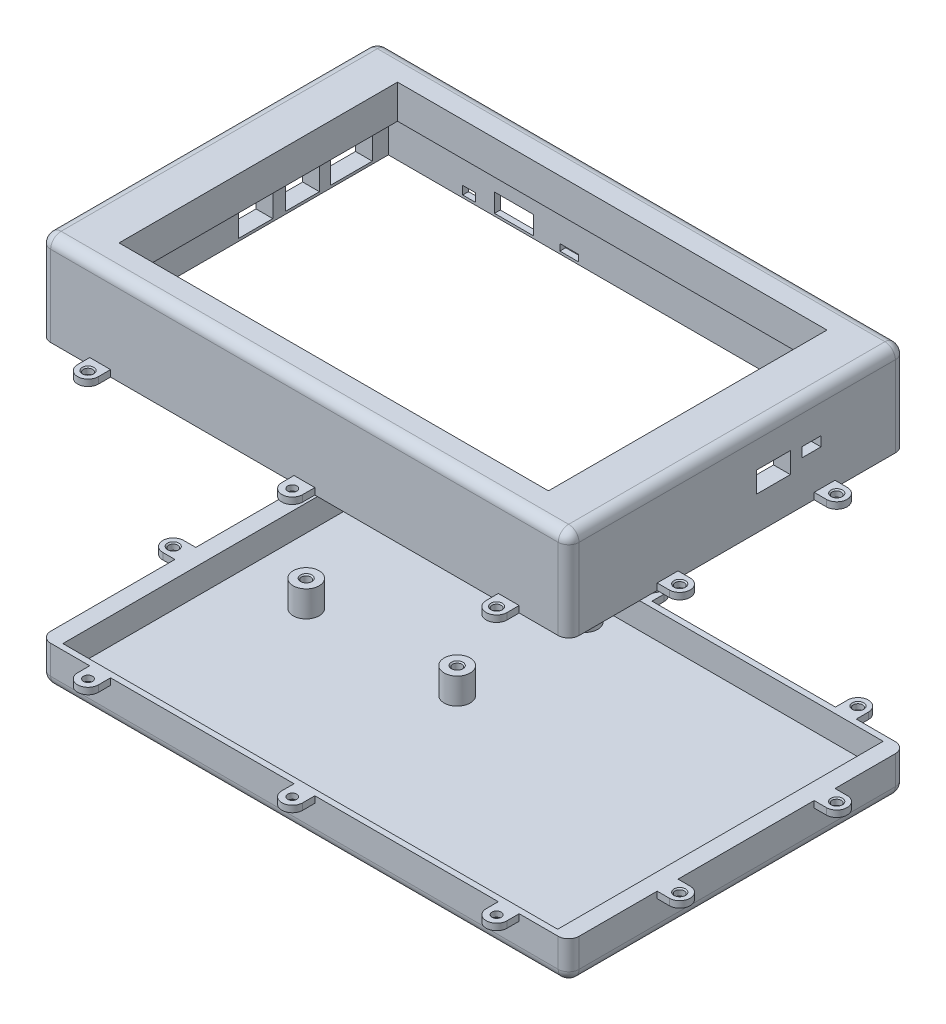
from build123d import *

# Parameters (mm, degrees)
SKETCH1_W                       = 202.9
SKETCH1_H                       = 129.45
BOSS_EXTRUDE1_DEPTH             = 25
FILLET3_R                       = 4
SKETCH2_W                       = 16
SKETCH2_H                       = 13.2
CUT_EXTRUDE1_DEPTH              = 21.6
SKETCH3_W                       = 13.1
SKETCH3_H                       = 16
CUT_EXTRUDE2_DEPTH              = 17.5
SKETCH4_W                       = 13.1
SKETCH4_H                       = 16
CUT_EXTRUDE3_DEPTH              = 17.5
SKETCH5_W                       = 4.9
SKETCH5_H                       = 3.2
CUT_EXTRUDE4_DEPTH              = 7.3
SKETCH7_W                       = 14.9
SKETCH7_H                       = 7.1
CUT_EXTRUDE5_DEPTH              = 11
SKETCH8_W                       = 7.2
SKETCH8_H                       = 2.5
CUT_EXTRUDE6_DEPTH              = 5
SKETCH17_W                      = 190
SKETCH17_H                      = 125
CUT_EXTRUDE9_DEPTH              = 10
SKETCH18_W                      = 164.9
SKETCH18_H                      = 106.95
CUT_EXTRUDE10_DEPTH             = 167.452480081
SKETCH19_W                      = 190
SKETCH19_H                      = 125
CUT_EXTRUDE11_DEPTH             = 22
SKETCH20_W                      = 8
SKETCH20_H                      = 2.5
BOSS_EXTRUDE2_DEPTH             = 8.66
FILLET4_RADIUS                  = 4
FILLET4_LENGTH                  = 2.5
SKETCH21_W                      = 8
SKETCH21_H                      = 2.5
BOSS_EXTRUDE3_DEPTH             = 8.66
FILLET5_RADIUS                  = 4
FILLET5_LENGTH                  = 2.5
SKETCH32_W                      = 8
SKETCH32_H                      = 2.5
BOSS_EXTRUDE6_DEPTH             = 8.66
BOSS_EXTRUDE6_2_DEPTH           = 8.66
BOSS_EXTRUDE6_3_DEPTH           = 8.66
FILLET8_RADIUS                  = 4
FILLET8_LENGTH                  = 2.5
FILLET9_RADIUS                  = 4
FILLET9_LENGTH                  = 2.5
FILLET10_RADIUS                 = 4
FILLET10_LENGTH                 = 2.5
SKETCH35_W                      = 8
SKETCH35_H                      = 2.5
BOSS_EXTRUDE7_DEPTH             = 8.66
FILLET11_RADIUS                 = 4
FILLET11_LENGTH                 = 2.5
FILLET12_RADIUS                 = 4
FILLET12_LENGTH                 = 2.5
FILLET13_RADIUS                 = 4
FILLET13_LENGTH                 = 2.5
F_1_0MM_DOWEL_HOLE6_AT_2_COUNT  = 2
F_1_0MM_DOWEL_HOLE6_AT_2_PITCH  = 78.45
F_1_0MM_DOWEL_HOLE6_AT_3_COUNT  = 2
F_1_0MM_DOWEL_HOLE6_AT_3_PITCH  = 156.9
SKETCH38_W                      = 8
SKETCH38_H                      = 2.5
BOSS_EXTRUDE8_DEPTH             = 8.66
BOSS_EXTRUDE8_2_DEPTH           = 8.66
SKETCH39_W                      = 8
SKETCH39_H                      = 2.5
BOSS_EXTRUDE9_DEPTH             = 8.66
FILLET14_RADIUS                 = 4
FILLET14_LENGTH                 = 2.5
FILLET15_RADIUS                 = 4
FILLET15_LENGTH                 = 2.5
FILLET16_RADIUS                 = 4
FILLET16_LENGTH                 = 2.5
FILLET17_RADIUS                 = 4
FILLET17_LENGTH                 = 2.5
F_1_0MM_DOWEL_HOLE8_AT_2_COUNT  = 2
F_1_0MM_DOWEL_HOLE8_AT_2_PITCH  = 60.28
SKETCH45_W                      = 8
SKETCH45_H                      = 2.5
BOSS_EXTRUDE10_DEPTH            = 8.66
BOSS_EXTRUDE10_2_DEPTH          = 8.66
BOSS_EXTRUDE10_3_DEPTH          = 8.66
FILLET18_RADIUS                 = 4
FILLET18_LENGTH                 = 2.5
FILLET19_RADIUS                 = 4
FILLET19_LENGTH                 = 2.5
FILLET20_RADIUS                 = 4
FILLET20_LENGTH                 = 2.5
SKETCH46_W                      = 8
SKETCH46_H                      = 2.5
BOSS_EXTRUDE11_DEPTH            = 8.66
FILLET21_RADIUS                 = 4
FILLET21_LENGTH                 = 2.5
FILLET22_RADIUS                 = 4
FILLET22_LENGTH                 = 2.5
FILLET23_RADIUS                 = 4
FILLET23_LENGTH                 = 2.5
F_1_0MM_DOWEL_HOLE9_AT_2_COUNT  = 2
F_1_0MM_DOWEL_HOLE9_AT_2_PITCH  = 78.45
F_1_0MM_DOWEL_HOLE9_AT_3_COUNT  = 2
F_1_0MM_DOWEL_HOLE9_AT_3_PITCH  = 156.9
SKETCH51_W                      = 7.2
SKETCH51_H                      = 3.7
SKETCH51_W_2                    = 13.1
SKETCH51_H_2                    = 8
CUT_EXTRUDE12_DEPTH             = 10
F_1_0MM_DOWEL_HOLE11_AT_2_COUNT = 2
F_1_0MM_DOWEL_HOLE11_AT_2_PITCH = 78.45
F_1_0MM_DOWEL_HOLE11_AT_3_COUNT = 2
F_1_0MM_DOWEL_HOLE11_AT_3_PITCH = 159.409897434
F_1_0MM_DOWEL_HOLE11_AT_4_COUNT = 2
F_1_0MM_DOWEL_HOLE11_AT_4_PITCH = 159.409897434
SKETCH58_R                      = 5
BOSS_EXTRUDE12_DEPTH            = 15
F_1_0MM_DOWEL_HOLE14_AT_2_COUNT = 2
F_1_0MM_DOWEL_HOLE14_AT_2_PITCH = 75.927597091
F_1_0MM_DOWEL_HOLE14_AT_3_COUNT = 2
F_1_0MM_DOWEL_HOLE14_AT_3_PITCH = 58
F_1_0MM_DOWEL_HOLE14_AT_4_COUNT = 2
F_1_0MM_DOWEL_HOLE14_AT_4_PITCH = 49


with BuildPart() as part:
    # Sketch1 → Boss-Extrude1 (new, symmetric)
    with BuildSketch(Plane(origin=(0, 0, 0), x_dir=(1, 0, 0), z_dir=(0, 1, 0))):
        Rectangle(SKETCH1_W, SKETCH1_H)
    extrude(amount=BOSS_EXTRUDE1_DEPTH, both=True)

    # Fillet3
    fillet3_edges = [part.edges().sort_by_distance(p)[0] for p in [
        (0, 25, -64.725),
        (101.45, 25, 0),
        (0, 25, 64.725),
        (101.45, -25, 0),
        (0, -25, -64.725),
        (-101.45, -25, 0),
        (0, -25, 64.725),
        (101.45, 0, 64.725),
        (101.45, 0, -64.725),
        (-101.45, 0, -64.725),
        (-101.45, 0, 64.725),
        (-101.45, 25, 0),
    ]]
    fillet(fillet3_edges, radius=FILLET3_R)

    # Sketch2 → Cut-Extrude1 (cut)
    with BuildSketch(Plane.ZY.offset(101.45)):
        with Locations((-48.33865756, -2.4)):
            Rectangle(SKETCH2_W, SKETCH2_H)
    extrude(amount=-CUT_EXTRUDE1_DEPTH, mode=Mode.SUBTRACT)

    # Sketch3 → Cut-Extrude2 (cut)
    with BuildSketch(Plane.ZY.offset(101.45)):
        with Locations((-29.48865756, -1)):
            Rectangle(SKETCH3_W, SKETCH3_H)
    extrude(amount=-CUT_EXTRUDE2_DEPTH, mode=Mode.SUBTRACT)

    # Sketch4 → Cut-Extrude3 (cut)
    with BuildSketch(Plane.ZY.offset(101.45)):
        with Locations((-11.58865756, -1)):
            Rectangle(SKETCH4_W, SKETCH4_H)
    extrude(amount=-CUT_EXTRUDE3_DEPTH, mode=Mode.SUBTRACT)

    # Sketch5 → Cut-Extrude4 (cut)
    with BuildSketch(Plane(origin=(0, 0, -64.725), x_dir=(-1, 0, 0), z_dir=(0, 0, -1))):
        with Locations((64, -7.45)):
            Rectangle(SKETCH5_W, SKETCH5_H)
    extrude(amount=-CUT_EXTRUDE4_DEPTH, mode=Mode.SUBTRACT)

    # Sketch7 → Cut-Extrude5 (cut)
    with BuildSketch(Plane(origin=(0, 0, -64.725), x_dir=(-1, 0, 0), z_dir=(0, 0, -1))):
        with Locations((46.8, -5.5)):
            Rectangle(SKETCH7_W, SKETCH7_H)
    extrude(amount=-CUT_EXTRUDE5_DEPTH, mode=Mode.SUBTRACT)

    # Sketch8 → Cut-Extrude6 (cut)
    with BuildSketch(Plane(origin=(0, 0, -64.725), x_dir=(-1, 0, 0), z_dir=(0, 0, -1))):
        with Locations((25.55, -7.8)):
            Rectangle(SKETCH8_W, SKETCH8_H)
    extrude(amount=-CUT_EXTRUDE6_DEPTH, mode=Mode.SUBTRACT)


with BuildPart() as body_2:
    # Split1: read off the stored shape, not the designer's step
    # Split1: the piece on the far side of the plane
    add(part.part)
    split(bisect_by=Plane(origin=(0, -10, 0), x_dir=(1, 0, 0), z_dir=(0, 1, 0)), keep=Keep.BOTTOM)

    # Sketch17 → Cut-Extrude9 (cut)
    with BuildSketch(Plane(origin=(0, -10, 0), x_dir=(1, 0, 0), z_dir=(0, 1, 0))):
        Rectangle(SKETCH17_W, SKETCH17_H)
    extrude(amount=-CUT_EXTRUDE9_DEPTH, mode=Mode.SUBTRACT)

    # Sketch21 → Boss-Extrude3 (add)
    with BuildSketch(Plane.ZY.offset(101.45)):
        with Locations((9, -11.25)):
            Rectangle(SKETCH21_W, SKETCH21_H)
    extrude(amount=BOSS_EXTRUDE3_DEPTH)

    # Fillet5: full round fillet: the end face becomes a half cylinder, R = half its width
    fillet5_face = Plane((-110.11, -11.25, 9), x_dir=(0, -1, 0), z_dir=(-1, 0, 0))  # on the end face: x along it, z out of the body
    fillet5_slab = fillet5_face.offset(-FILLET5_RADIUS / 2) * Box(FILLET5_LENGTH, 2 * FILLET5_RADIUS, FILLET5_RADIUS, mode=Mode.PRIVATE)  # the body's end, R deep
    fillet5_round = Plane((-106.11, -11.25, 9), x_dir=(-1, 0, 0), z_dir=(0, -1, 0)) * Cylinder(FILLET5_RADIUS, FILLET5_LENGTH, mode=Mode.PRIVATE)  # its axis R under the face
    add(fillet5_slab - fillet5_round, mode=Mode.SUBTRACT)

    # Sketch25 → Ø1.0mm Dowel Hole2 (revolve, cut)
    with BuildSketch(Plane(origin=(-106.11, -10, 9), x_dir=(0, 0, 1), z_dir=(1, 0, 0))):
        Polygon((0, 0), (0, 2.5), (1.75, 2.5), (1.75, 0.45), (2.2, 0), align=None)
    revolve(axis=Axis((-106.11, -3.65, 9), (0, -1, 0)), mode=Mode.SUBTRACT)

    # Sketch35 → Boss-Extrude7 (add)
    with BuildSketch(Plane(origin=(0, 0, -64.725), x_dir=(-1, 0, 0), z_dir=(0, 0, -1))):
        with Locations((78.45, -11.25)):
            Rectangle(SKETCH35_W, SKETCH35_H)
        with Locations((-78.45, -11.25)):
            Rectangle(SKETCH35_W, SKETCH35_H)
        with Locations((0, -11.25)):
            Rectangle(SKETCH35_W, SKETCH35_H)
    extrude(amount=BOSS_EXTRUDE7_DEPTH)

    # Fillet11: full round fillet: the end face becomes a half cylinder, R = half its width
    fillet11_face = Plane((78.45, -11.25, -73.385), x_dir=(0, 1, 0), z_dir=(0, 0, -1))  # on the end face: x along it, z out of the body
    fillet11_slab = fillet11_face.offset(-FILLET11_RADIUS / 2) * Box(FILLET11_LENGTH, 2 * FILLET11_RADIUS, FILLET11_RADIUS, mode=Mode.PRIVATE)  # the body's end, R deep
    fillet11_round = Plane((78.45, -11.25, -69.385), x_dir=(0, 0, -1), z_dir=(0, 1, 0)) * Cylinder(FILLET11_RADIUS, FILLET11_LENGTH, mode=Mode.PRIVATE)  # its axis R under the face
    add(fillet11_slab - fillet11_round, mode=Mode.SUBTRACT)

    # Fillet12: full round fillet: the end face becomes a half cylinder, R = half its width
    fillet12_face = Plane((0, -11.25, -73.385), x_dir=(0, -1, 0), z_dir=(0, 0, -1))  # on the end face: x along it, z out of the body
    fillet12_slab = fillet12_face.offset(-FILLET12_RADIUS / 2) * Box(FILLET12_LENGTH, 2 * FILLET12_RADIUS, FILLET12_RADIUS, mode=Mode.PRIVATE)  # the body's end, R deep
    fillet12_round = Plane((0, -11.25, -69.385), x_dir=(0, 0, -1), z_dir=(0, -1, 0)) * Cylinder(FILLET12_RADIUS, FILLET12_LENGTH, mode=Mode.PRIVATE)  # its axis R under the face
    add(fillet12_slab - fillet12_round, mode=Mode.SUBTRACT)

    # Fillet13: full round fillet: the end face becomes a half cylinder, R = half its width
    fillet13_face = Plane((-78.45, -11.25, -73.385), x_dir=(0, -1, 0), z_dir=(0, 0, -1))  # on the end face: x along it, z out of the body
    fillet13_slab = fillet13_face.offset(-FILLET13_RADIUS / 2) * Box(FILLET13_LENGTH, 2 * FILLET13_RADIUS, FILLET13_RADIUS, mode=Mode.PRIVATE)  # the body's end, R deep
    fillet13_round = Plane((-78.45, -11.25, -69.385), x_dir=(0, 0, -1), z_dir=(0, -1, 0)) * Cylinder(FILLET13_RADIUS, FILLET13_LENGTH, mode=Mode.PRIVATE)  # its axis R under the face
    add(fillet13_slab - fillet13_round, mode=Mode.SUBTRACT)

    # Sketch37 → Ø1.0mm Dowel Hole6 (revolve, cut)
    with BuildSketch(Plane(origin=(-78.45, -10, -69.385), x_dir=(0, 0, 1), z_dir=(1, 0, 0))):
        Polygon((0, 0), (0, 2.501), (1.75, 2.501), (1.75, 0.45), (2.2, 0), align=None)
    f_1_0mm_dowel_hole6 = revolve(axis=Axis((-78.45, -3.65, -69.385), (0, -1, 0)), mode=Mode.SUBTRACT)

    # Ø1.0mm Dowel Hole6 at 2: Ø1.0mm Dowel Hole6 ×2
    with Locations(*[(i * F_1_0MM_DOWEL_HOLE6_AT_2_PITCH, 0, 0) for i in range(1, F_1_0MM_DOWEL_HOLE6_AT_2_COUNT)]):
        add(f_1_0mm_dowel_hole6, mode=Mode.SUBTRACT)

    # Ø1.0mm Dowel Hole6 at 3: Ø1.0mm Dowel Hole6 ×2
    with Locations(*[(i * F_1_0MM_DOWEL_HOLE6_AT_3_PITCH, 0, 0) for i in range(1, F_1_0MM_DOWEL_HOLE6_AT_3_COUNT)]):
        add(f_1_0mm_dowel_hole6, mode=Mode.SUBTRACT)

    # Sketch39 → Boss-Extrude9 (add)
    with BuildSketch(Plane(origin=(101.45, 0, 0), x_dir=(0, 0, -1), z_dir=(1, 0, 0))):
        with Locations((-26.725, -11.25)):
            Rectangle(SKETCH39_W, SKETCH39_H)
        with Locations((33.555, -11.25)):
            Rectangle(SKETCH39_W, SKETCH39_H)
    extrude(amount=BOSS_EXTRUDE9_DEPTH)

    # Fillet16: full round fillet: the end face becomes a half cylinder, R = half its width
    fillet16_face = Plane((110.11, -11.25, -33.555), x_dir=(0, -1, 0), z_dir=(1, 0, 0))  # on the end face: x along it, z out of the body
    fillet16_slab = fillet16_face.offset(-FILLET16_RADIUS / 2) * Box(FILLET16_LENGTH, 2 * FILLET16_RADIUS, FILLET16_RADIUS, mode=Mode.PRIVATE)  # the body's end, R deep
    fillet16_round = Plane((106.11, -11.25, -33.555), x_dir=(1, 0, 0), z_dir=(0, -1, 0)) * Cylinder(FILLET16_RADIUS, FILLET16_LENGTH, mode=Mode.PRIVATE)  # its axis R under the face
    add(fillet16_slab - fillet16_round, mode=Mode.SUBTRACT)

    # Fillet17: full round fillet: the end face becomes a half cylinder, R = half its width
    fillet17_face = Plane((110.11, -11.25, 26.725), x_dir=(0, 1, 0), z_dir=(1, 0, 0))  # on the end face: x along it, z out of the body
    fillet17_slab = fillet17_face.offset(-FILLET17_RADIUS / 2) * Box(FILLET17_LENGTH, 2 * FILLET17_RADIUS, FILLET17_RADIUS, mode=Mode.PRIVATE)  # the body's end, R deep
    fillet17_round = Plane((106.11, -11.25, 26.725), x_dir=(1, 0, 0), z_dir=(0, 1, 0)) * Cylinder(FILLET17_RADIUS, FILLET17_LENGTH, mode=Mode.PRIVATE)  # its axis R under the face
    add(fillet17_slab - fillet17_round, mode=Mode.SUBTRACT)

    # Sketch44 → Ø1.0mm Dowel Hole8 (revolve, cut)
    with BuildSketch(Plane(origin=(106.11, -10, 26.725), x_dir=(0, 0, 1), z_dir=(1, 0, 0))):
        Polygon((0, 0), (0, 2.501), (1.75, 2.501), (1.75, 0.45), (2.2, 0), align=None)
    f_1_0mm_dowel_hole8 = revolve(axis=Axis((106.11, -3.65, 26.725), (0, -1, 0)), mode=Mode.SUBTRACT)

    # Ø1.0mm Dowel Hole8 at 2: Ø1.0mm Dowel Hole8 ×2
    with Locations(*[(0, 0, -i * F_1_0MM_DOWEL_HOLE8_AT_2_PITCH) for i in range(1, F_1_0MM_DOWEL_HOLE8_AT_2_COUNT)]):
        add(f_1_0mm_dowel_hole8, mode=Mode.SUBTRACT)

    # Sketch46 → Boss-Extrude11 (add)
    with BuildSketch(Plane.XY.offset(64.725)):
        with Locations((78.45, -11.25)):
            Rectangle(SKETCH46_W, SKETCH46_H)
        with Locations((-78.45, -11.25)):
            Rectangle(SKETCH46_W, SKETCH46_H)
        with Locations((0, -11.25)):
            Rectangle(SKETCH46_W, SKETCH46_H)
    extrude(amount=BOSS_EXTRUDE11_DEPTH)

    # Fillet21: full round fillet: the end face becomes a half cylinder, R = half its width
    fillet21_face = Plane((78.45, -11.25, 73.385), x_dir=(0, 1, 0), z_dir=(0, 0, 1))  # on the end face: x along it, z out of the body
    fillet21_slab = fillet21_face.offset(-FILLET21_RADIUS / 2) * Box(FILLET21_LENGTH, 2 * FILLET21_RADIUS, FILLET21_RADIUS, mode=Mode.PRIVATE)  # the body's end, R deep
    fillet21_round = Plane((78.45, -11.25, 69.385), x_dir=(0, 0, 1), z_dir=(0, 1, 0)) * Cylinder(FILLET21_RADIUS, FILLET21_LENGTH, mode=Mode.PRIVATE)  # its axis R under the face
    add(fillet21_slab - fillet21_round, mode=Mode.SUBTRACT)

    # Fillet22: full round fillet: the end face becomes a half cylinder, R = half its width
    fillet22_face = Plane((0, -11.25, 73.385), x_dir=(0, 1, 0), z_dir=(0, 0, 1))  # on the end face: x along it, z out of the body
    fillet22_slab = fillet22_face.offset(-FILLET22_RADIUS / 2) * Box(FILLET22_LENGTH, 2 * FILLET22_RADIUS, FILLET22_RADIUS, mode=Mode.PRIVATE)  # the body's end, R deep
    fillet22_round = Plane((0, -11.25, 69.385), x_dir=(0, 0, 1), z_dir=(0, 1, 0)) * Cylinder(FILLET22_RADIUS, FILLET22_LENGTH, mode=Mode.PRIVATE)  # its axis R under the face
    add(fillet22_slab - fillet22_round, mode=Mode.SUBTRACT)

    # Fillet23: full round fillet: the end face becomes a half cylinder, R = half its width
    fillet23_face = Plane((-78.45, -11.25, 73.385), x_dir=(0, 1, 0), z_dir=(0, 0, 1))  # on the end face: x along it, z out of the body
    fillet23_slab = fillet23_face.offset(-FILLET23_RADIUS / 2) * Box(FILLET23_LENGTH, 2 * FILLET23_RADIUS, FILLET23_RADIUS, mode=Mode.PRIVATE)  # the body's end, R deep
    fillet23_round = Plane((-78.45, -11.25, 69.385), x_dir=(0, 0, 1), z_dir=(0, 1, 0)) * Cylinder(FILLET23_RADIUS, FILLET23_LENGTH, mode=Mode.PRIVATE)  # its axis R under the face
    add(fillet23_slab - fillet23_round, mode=Mode.SUBTRACT)

    # Sketch48 → Ø1.0mm Dowel Hole9 (revolve, cut)
    with BuildSketch(Plane(origin=(78.45, -12.5, 69.385), x_dir=(0, 0, -1), z_dir=(1, 0, 0))):
        Polygon((0, 0), (0, 2.501), (1.75, 2.501), (1.75, 0.45), (2.2, 0), align=None)
    f_1_0mm_dowel_hole9 = revolve(axis=Axis((78.45, -18.85, 69.385), (0, 1, 0)), mode=Mode.SUBTRACT)

    # Ø1.0mm Dowel Hole9 at 2: Ø1.0mm Dowel Hole9 ×2
    with Locations(*[(-i * F_1_0MM_DOWEL_HOLE9_AT_2_PITCH, 0, 0) for i in range(1, F_1_0MM_DOWEL_HOLE9_AT_2_COUNT)]):
        add(f_1_0mm_dowel_hole9, mode=Mode.SUBTRACT)

    # Ø1.0mm Dowel Hole9 at 3: Ø1.0mm Dowel Hole9 ×2
    with Locations(*[(-i * F_1_0MM_DOWEL_HOLE9_AT_3_PITCH, 0, 0) for i in range(1, F_1_0MM_DOWEL_HOLE9_AT_3_COUNT)]):
        add(f_1_0mm_dowel_hole9, mode=Mode.SUBTRACT)

    # Sketch58 → Boss-Extrude12 (add)
    with BuildSketch(Plane(origin=(0, -25, 0), x_dir=(-1, 0, 0), z_dir=(0, -1, 0))):
        with Locations(Location((12, 5.935, 0), (0, 0, 90))):
            Circle(SKETCH58_R)
        with Locations(Location((70, 54.935, 0), (0, 0, 90))):
            Circle(SKETCH58_R)
        with Locations(Location((70, 5.935, 0), (0, 0, 90))):
            Circle(SKETCH58_R)
        with Locations(Location((12, 54.935, 0), (0, 0, 90))):
            Circle(SKETCH58_R)
    extrude(amount=-BOSS_EXTRUDE12_DEPTH)

    # Sketch62 → Ø1.0mm Dowel Hole14 (revolve, cut)
    with BuildSketch(Plane(origin=(-12, -10, -54.935), x_dir=(0, 0, 1), z_dir=(1, 0, 0))):
        Polygon((0, 0), (0, 8.051506083), (1.75, 7), (1.75, 0.45), (2.2, 0), align=None)
    f_1_0mm_dowel_hole14 = revolve(axis=Axis((-12, -3.65, -54.935), (0, -1, 0)), mode=Mode.SUBTRACT)

    # Ø1.0mm Dowel Hole14 at 2: Ø1.0mm Dowel Hole14 ×2
    with Locations(*[Vector(-0.7638856255460448, 0, 0.6453516491682096) * (i * F_1_0MM_DOWEL_HOLE14_AT_2_PITCH) for i in range(1, F_1_0MM_DOWEL_HOLE14_AT_2_COUNT)]):
        add(f_1_0mm_dowel_hole14, mode=Mode.SUBTRACT)

    # Ø1.0mm Dowel Hole14 at 3: Ø1.0mm Dowel Hole14 ×2
    with Locations(*[(-i * F_1_0MM_DOWEL_HOLE14_AT_3_PITCH, 0, 0) for i in range(1, F_1_0MM_DOWEL_HOLE14_AT_3_COUNT)]):
        add(f_1_0mm_dowel_hole14, mode=Mode.SUBTRACT)

    # Ø1.0mm Dowel Hole14 at 4: Ø1.0mm Dowel Hole14 ×2
    with Locations(*[(0, 0, i * F_1_0MM_DOWEL_HOLE14_AT_4_PITCH) for i in range(1, F_1_0MM_DOWEL_HOLE14_AT_4_COUNT)]):
        add(f_1_0mm_dowel_hole14, mode=Mode.SUBTRACT)


with BuildPart() as part_1:
    add(part.part)

    # Split1
    split(bisect_by=Plane(origin=(0, -10, 0), x_dir=(1, 0, 0), z_dir=(0, 1, 0)), keep=Keep.TOP)


with BuildPart() as part_2:
    # Body-Move/Copy2: read off the stored shape, not the designer's step
    # Body-Move/Copy2: moved
    add(part_1.part.moved(Location((0, 100, 0))))

    # Sketch18 → Cut-Extrude10 (cut, through all)
    with BuildSketch(Plane.XZ.offset(-90)):
        Rectangle(SKETCH18_W, SKETCH18_H)
    extrude(amount=-CUT_EXTRUDE10_DEPTH, mode=Mode.SUBTRACT)

    # Sketch19 → Cut-Extrude11 (cut)
    with BuildSketch(Plane.XZ.offset(-90)):
        Rectangle(SKETCH19_W, SKETCH19_H)
    extrude(amount=-CUT_EXTRUDE11_DEPTH, mode=Mode.SUBTRACT)

    # Sketch20 → Boss-Extrude2 (add)
    with BuildSketch(Plane.ZY.offset(101.45)):
        with Locations((9, 91.25)):
            Rectangle(SKETCH20_W, SKETCH20_H)
    extrude(amount=BOSS_EXTRUDE2_DEPTH)

    # Fillet4: full round fillet: the end face becomes a half cylinder, R = half its width
    fillet4_face = Plane((-110.11, 91.25, 9), x_dir=(0, -1, 0), z_dir=(-1, 0, 0))  # on the end face: x along it, z out of the body
    fillet4_slab = fillet4_face.offset(-FILLET4_RADIUS / 2) * Box(FILLET4_LENGTH, 2 * FILLET4_RADIUS, FILLET4_RADIUS, mode=Mode.PRIVATE)  # the body's end, R deep
    fillet4_round = Plane((-106.11, 91.25, 9), x_dir=(-1, 0, 0), z_dir=(0, -1, 0)) * Cylinder(FILLET4_RADIUS, FILLET4_LENGTH, mode=Mode.PRIVATE)  # its axis R under the face
    add(fillet4_slab - fillet4_round, mode=Mode.SUBTRACT)

    # Sketch23 → Ø1.0mm Dowel Hole1 (revolve, cut)
    with BuildSketch(Plane(origin=(-106.11, 92.5, 9), x_dir=(0, 0, 1), z_dir=(1, 0, 0))):
        Polygon((0, 0), (0, 2.5), (1.75, 2.5), (1.75, 0.45), (2.2, 0), align=None)
    revolve(axis=Axis((-106.11, 98.85, 9), (0, -1, 0)), mode=Mode.SUBTRACT)

    # Sketch51 → Cut-Extrude12 (cut)
    with BuildSketch(Plane(origin=(101.45, 0, 0), x_dir=(0, 0, -1), z_dir=(1, 0, 0))):
        with Locations((28.571922671, 108.15)):
            Rectangle(SKETCH51_W, SKETCH51_H)
        with Locations((13.87, 106.95)):
            Rectangle(SKETCH51_W_2, SKETCH51_H_2)
    extrude(amount=-CUT_EXTRUDE12_DEPTH, mode=Mode.SUBTRACT)


with BuildPart() as body_3:
    # Sketch32 → Boss-Extrude6 (new body)
    with BuildSketch(Plane(origin=(0, 0, -64.725), x_dir=(-1, 0, 0), z_dir=(0, 0, -1))):
        with Locations((78.45, 91.25)):
            Rectangle(SKETCH32_W, SKETCH32_H)
    extrude(amount=BOSS_EXTRUDE6_DEPTH)

    # Fillet10: full round fillet: the end face becomes a half cylinder, R = half its width
    fillet10_face = Plane((-78.45, 91.25, -73.385), x_dir=(0, -1, 0), z_dir=(0, 0, -1))  # on the end face: x along it, z out of the body
    fillet10_slab = fillet10_face.offset(-FILLET10_RADIUS / 2) * Box(FILLET10_LENGTH, 2 * FILLET10_RADIUS, FILLET10_RADIUS, mode=Mode.PRIVATE)  # the body's end, R deep
    fillet10_round = Plane((-78.45, 91.25, -69.385), x_dir=(0, 0, -1), z_dir=(0, -1, 0)) * Cylinder(FILLET10_RADIUS, FILLET10_LENGTH, mode=Mode.PRIVATE)  # its axis R under the face
    add(fillet10_slab - fillet10_round, mode=Mode.SUBTRACT)

    # Sketch34 → Ø1.0mm Dowel Hole5 (revolve, cut)
    with BuildSketch(Plane(origin=(-78.45, 92.5, -69.385), x_dir=(0, 0, 1), z_dir=(1, 0, 0))):
        Polygon((0, 0), (0, 2.501), (1.75, 2.501), (1.75, 0.45), (2.2, 0), align=None)
    revolve(axis=Axis((-78.45, 98.85, -69.385), (0, -1, 0)), mode=Mode.SUBTRACT)


with BuildPart() as body_4:
    # Sketch32 → Boss-Extrude6 2 (new body)
    with BuildSketch(Plane(origin=(0, 0, -64.725), x_dir=(-1, 0, 0), z_dir=(0, 0, -1))):
        with Locations((-78.45, 91.25)):
            Rectangle(SKETCH32_W, SKETCH32_H)
    extrude(amount=BOSS_EXTRUDE6_2_DEPTH)

    # Fillet8: full round fillet: the end face becomes a half cylinder, R = half its width
    fillet8_face = Plane((78.45, 91.25, -73.385), x_dir=(0, -1, 0), z_dir=(0, 0, -1))  # on the end face: x along it, z out of the body
    fillet8_slab = fillet8_face.offset(-FILLET8_RADIUS / 2) * Box(FILLET8_LENGTH, 2 * FILLET8_RADIUS, FILLET8_RADIUS, mode=Mode.PRIVATE)  # the body's end, R deep
    fillet8_round = Plane((78.45, 91.25, -69.385), x_dir=(0, 0, -1), z_dir=(0, -1, 0)) * Cylinder(FILLET8_RADIUS, FILLET8_LENGTH, mode=Mode.PRIVATE)  # its axis R under the face
    add(fillet8_slab - fillet8_round, mode=Mode.SUBTRACT)


with BuildPart() as body_5:
    # Sketch32 → Boss-Extrude6 3 (new body)
    with BuildSketch(Plane(origin=(0, 0, -64.725), x_dir=(-1, 0, 0), z_dir=(0, 0, -1))):
        with Locations((0, 91.25)):
            Rectangle(SKETCH32_W, SKETCH32_H)
    extrude(amount=BOSS_EXTRUDE6_3_DEPTH)

    # Fillet9: full round fillet: the end face becomes a half cylinder, R = half its width
    fillet9_face = Plane((0, 91.25, -73.385), x_dir=(0, -1, 0), z_dir=(0, 0, -1))  # on the end face: x along it, z out of the body
    fillet9_slab = fillet9_face.offset(-FILLET9_RADIUS / 2) * Box(FILLET9_LENGTH, 2 * FILLET9_RADIUS, FILLET9_RADIUS, mode=Mode.PRIVATE)  # the body's end, R deep
    fillet9_round = Plane((0, 91.25, -69.385), x_dir=(0, 0, -1), z_dir=(0, -1, 0)) * Cylinder(FILLET9_RADIUS, FILLET9_LENGTH, mode=Mode.PRIVATE)  # its axis R under the face
    add(fillet9_slab - fillet9_round, mode=Mode.SUBTRACT)

    # Sketch55 → Ø1.0mm Dowel Hole11 (revolve, cut)
    with BuildSketch(Plane(origin=(0, 92.5, -69.385), x_dir=(0, 0, 1), z_dir=(1, 0, 0))):
        Polygon((0, 0), (0, 2.5), (1.75, 2.5), (1.75, 0.45), (2.2, 0), align=None)
    f_1_0mm_dowel_hole11 = revolve(axis=Axis((0, 98.85, -69.385), (0, -1, 0)), mode=Mode.SUBTRACT)


with BuildPart() as body_6:
    # Sketch38 → Boss-Extrude8 (new body)
    with BuildSketch(Plane(origin=(101.45, 0, 0), x_dir=(0, 0, -1), z_dir=(1, 0, 0))):
        with Locations((-26.725, 91.25)):
            Rectangle(SKETCH38_W, SKETCH38_H)
    extrude(amount=BOSS_EXTRUDE8_DEPTH)

    # Fillet14: full round fillet: the end face becomes a half cylinder, R = half its width
    fillet14_face = Plane((110.11, 91.25, 26.725), x_dir=(0, -1, 0), z_dir=(1, 0, 0))  # on the end face: x along it, z out of the body
    fillet14_slab = fillet14_face.offset(-FILLET14_RADIUS / 2) * Box(FILLET14_LENGTH, 2 * FILLET14_RADIUS, FILLET14_RADIUS, mode=Mode.PRIVATE)  # the body's end, R deep
    fillet14_round = Plane((106.11, 91.25, 26.725), x_dir=(1, 0, 0), z_dir=(0, -1, 0)) * Cylinder(FILLET14_RADIUS, FILLET14_LENGTH, mode=Mode.PRIVATE)  # its axis R under the face
    add(fillet14_slab - fillet14_round, mode=Mode.SUBTRACT)

    # Sketch57 → Ø1.0mm Dowel Hole12 (revolve, cut)
    with BuildSketch(Plane(origin=(106.11, 92.5, 26.725), x_dir=(0, 0, 1), z_dir=(1, 0, 0))):
        Polygon((0, 0), (0, 2.501), (1.75, 2.501), (1.75, 0.45), (2.2, 0), align=None)
    revolve(axis=Axis((106.11, 98.85, 26.725), (0, -1, 0)), mode=Mode.SUBTRACT)


with BuildPart() as body_7:
    # Sketch38 → Boss-Extrude8 2 (new body)
    with BuildSketch(Plane(origin=(101.45, 0, 0), x_dir=(0, 0, -1), z_dir=(1, 0, 0))):
        with Locations((33.555, 91.25)):
            Rectangle(SKETCH38_W, SKETCH38_H)
    extrude(amount=BOSS_EXTRUDE8_2_DEPTH)

    # Fillet15: full round fillet: the end face becomes a half cylinder, R = half its width
    fillet15_face = Plane((110.11, 91.25, -33.555), x_dir=(0, -1, 0), z_dir=(1, 0, 0))  # on the end face: x along it, z out of the body
    fillet15_slab = fillet15_face.offset(-FILLET15_RADIUS / 2) * Box(FILLET15_LENGTH, 2 * FILLET15_RADIUS, FILLET15_RADIUS, mode=Mode.PRIVATE)  # the body's end, R deep
    fillet15_round = Plane((106.11, 91.25, -33.555), x_dir=(1, 0, 0), z_dir=(0, -1, 0)) * Cylinder(FILLET15_RADIUS, FILLET15_LENGTH, mode=Mode.PRIVATE)  # its axis R under the face
    add(fillet15_slab - fillet15_round, mode=Mode.SUBTRACT)

    # Ø1.0mm Dowel Hole7: read off the stored shape, not the designer's step
    # Ø1.0mm Dowel Hole7 outline → Ø1.0mm Dowel Hole7 (revolve, cut)
    with BuildSketch(Plane(origin=(106.11, 0, -33.555), x_dir=(1, 0, 0), z_dir=(0, 0, 1))):
        Polygon((0, 90), (1.75, 90), (1.75, 92.05), (2.2, 92.5), (0, 92.5), align=None)
    revolve(axis=Axis((106.11, 0, -33.555), (0, 1, 0)), mode=Mode.SUBTRACT)


with BuildPart() as body_8:
    # Sketch45 → Boss-Extrude10 (new body)
    with BuildSketch(Plane.XY.offset(64.725)):
        with Locations((-78.45, 91.25)):
            Rectangle(SKETCH45_W, SKETCH45_H)
    extrude(amount=BOSS_EXTRUDE10_DEPTH)

    # Fillet19: full round fillet: the end face becomes a half cylinder, R = half its width
    fillet19_face = Plane((-78.45, 91.25, 73.385), x_dir=(0, 1, 0), z_dir=(0, 0, 1))  # on the end face: x along it, z out of the body
    fillet19_slab = fillet19_face.offset(-FILLET19_RADIUS / 2) * Box(FILLET19_LENGTH, 2 * FILLET19_RADIUS, FILLET19_RADIUS, mode=Mode.PRIVATE)  # the body's end, R deep
    fillet19_round = Plane((-78.45, 91.25, 69.385), x_dir=(0, 0, 1), z_dir=(0, 1, 0)) * Cylinder(FILLET19_RADIUS, FILLET19_LENGTH, mode=Mode.PRIVATE)  # its axis R under the face
    add(fillet19_slab - fillet19_round, mode=Mode.SUBTRACT)

    # Ø1.0mm Dowel Hole11 at 4: Ø1.0mm Dowel Hole11 ×2
    with Locations(*[Vector(-0.4921275357595312, 0, 0.8705231120121115) * (i * F_1_0MM_DOWEL_HOLE11_AT_4_PITCH) for i in range(1, F_1_0MM_DOWEL_HOLE11_AT_4_COUNT)]):
        add(f_1_0mm_dowel_hole11, mode=Mode.SUBTRACT)


with BuildPart() as body_9:
    # Sketch45 → Boss-Extrude10 2 (new body)
    with BuildSketch(Plane.XY.offset(64.725)):
        with Locations((78.45, 91.25)):
            Rectangle(SKETCH45_W, SKETCH45_H)
    extrude(amount=BOSS_EXTRUDE10_2_DEPTH)

    # Fillet18: full round fillet: the end face becomes a half cylinder, R = half its width
    fillet18_face = Plane((78.45, 91.25, 73.385), x_dir=(0, 1, 0), z_dir=(0, 0, 1))  # on the end face: x along it, z out of the body
    fillet18_slab = fillet18_face.offset(-FILLET18_RADIUS / 2) * Box(FILLET18_LENGTH, 2 * FILLET18_RADIUS, FILLET18_RADIUS, mode=Mode.PRIVATE)  # the body's end, R deep
    fillet18_round = Plane((78.45, 91.25, 69.385), x_dir=(0, 0, 1), z_dir=(0, 1, 0)) * Cylinder(FILLET18_RADIUS, FILLET18_LENGTH, mode=Mode.PRIVATE)  # its axis R under the face
    add(fillet18_slab - fillet18_round, mode=Mode.SUBTRACT)

    # Ø1.0mm Dowel Hole11 at 3: Ø1.0mm Dowel Hole11 ×2
    with Locations(*[Vector(0.4921275357595314, 0, 0.8705231120121115) * (i * F_1_0MM_DOWEL_HOLE11_AT_3_PITCH) for i in range(1, F_1_0MM_DOWEL_HOLE11_AT_3_COUNT)]):
        add(f_1_0mm_dowel_hole11, mode=Mode.SUBTRACT)


with BuildPart() as body_10:
    # Sketch45 → Boss-Extrude10 3 (new body)
    with BuildSketch(Plane.XY.offset(64.725)):
        with Locations((0, 91.25)):
            Rectangle(SKETCH45_W, SKETCH45_H)
    extrude(amount=BOSS_EXTRUDE10_3_DEPTH)

    # Fillet20: full round fillet: the end face becomes a half cylinder, R = half its width
    fillet20_face = Plane((0, 91.25, 73.385), x_dir=(0, -1, 0), z_dir=(0, 0, 1))  # on the end face: x along it, z out of the body
    fillet20_slab = fillet20_face.offset(-FILLET20_RADIUS / 2) * Box(FILLET20_LENGTH, 2 * FILLET20_RADIUS, FILLET20_RADIUS, mode=Mode.PRIVATE)  # the body's end, R deep
    fillet20_round = Plane((0, 91.25, 69.385), x_dir=(0, 0, 1), z_dir=(0, -1, 0)) * Cylinder(FILLET20_RADIUS, FILLET20_LENGTH, mode=Mode.PRIVATE)  # its axis R under the face
    add(fillet20_slab - fillet20_round, mode=Mode.SUBTRACT)

    # Ø1.0mm Dowel Hole10: read off the stored shape, not the designer's step
    # Ø1.0mm Dowel Hole10 outline → Ø1.0mm Dowel Hole10 (revolve, cut)
    with BuildSketch(Plane.XY.offset(69.385)):
        Polygon((1.75, 90.45), (1.75, 92.5), (0, 92.5), (0, 90), (2.2, 90), align=None)
    revolve(axis=Axis((0, 0, 69.385), (0, 1, 0)), mode=Mode.SUBTRACT)


with BuildPart() as body_4_1:
    add(body_4.part)

    # Ø1.0mm Dowel Hole11 at 2: Ø1.0mm Dowel Hole11 ×2
    with Locations(*[(i * F_1_0MM_DOWEL_HOLE11_AT_2_PITCH, 0, 0) for i in range(1, F_1_0MM_DOWEL_HOLE11_AT_2_COUNT)]):
        add(f_1_0mm_dowel_hole11, mode=Mode.SUBTRACT)


solid = Compound([body_2.part, part_2.part, body_3.part, body_5.part, body_6.part, body_7.part, body_8.part, body_9.part, body_10.part, body_4_1.part])
